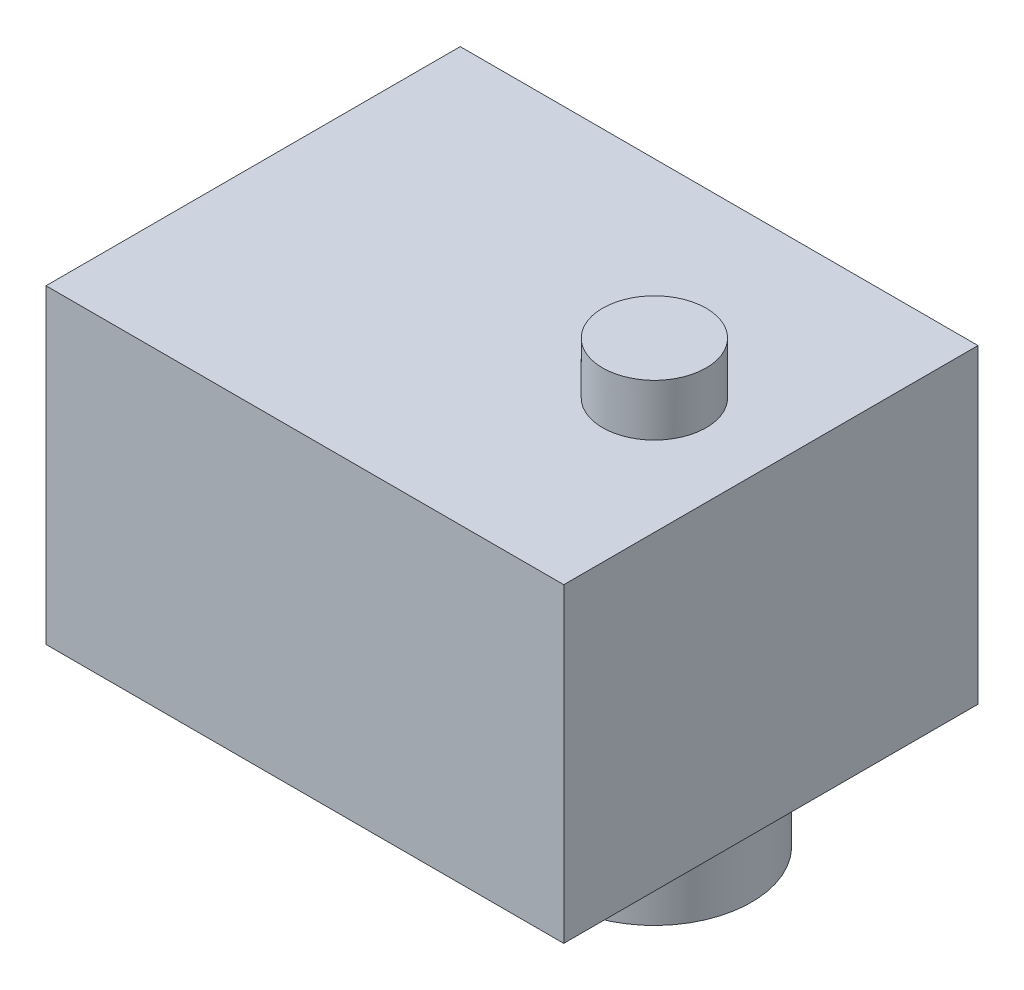
from build123d import *

# Parameters (mm, degrees)
SKETCH_1_W      = 20
SKETCH_1_H      = 16
EXTRUDE_1_DEPTH = 12
SKETCH_2_R      = 2
EXTRUDE_2_DEPTH = 2
SKETCH_3_R      = 3.75
EXTRUDE_3_DEPTH = 3
SKETCH_4_R      = 2
EXTRUDE_4_DEPTH = 2
EXTRUDE_4_TAPER = 30


with BuildPart() as part:
    # Эскиз1 → Бобышка-Вытянуть1 (new body)
    with BuildSketch(Plane(origin=(0, 0, 0), x_dir=(1, 0, 0), z_dir=(0, 1, 0))):
        with Locations((10, 8)):
            Rectangle(SKETCH_1_W, SKETCH_1_H)
    extrude(amount=EXTRUDE_1_DEPTH)

    # Эскиз2 → Бобышка-Вытянуть2 (add)
    with BuildSketch(Plane(origin=(0, 12, 0), x_dir=(1, 0, 0), z_dir=(0, 1, 0))):
        with Locations((15.5, 8)):
            Circle(SKETCH_2_R)
    extrude(amount=EXTRUDE_2_DEPTH)

    # Эскиз3 → Бобышка-Вытянуть3 (add)
    with BuildSketch(Plane.XZ):
        with Locations((15.5, -8)):
            Circle(SKETCH_3_R)
    extrude(amount=EXTRUDE_3_DEPTH)

    # Эскиз4 → Бобышка-Вытянуть4 (add)
    with BuildSketch(Plane.XZ.offset(3)):
        with Locations((15.5, -8)):
            Circle(SKETCH_4_R)
    extrude(amount=EXTRUDE_4_DEPTH, taper=EXTRUDE_4_TAPER)


solid = part.part
